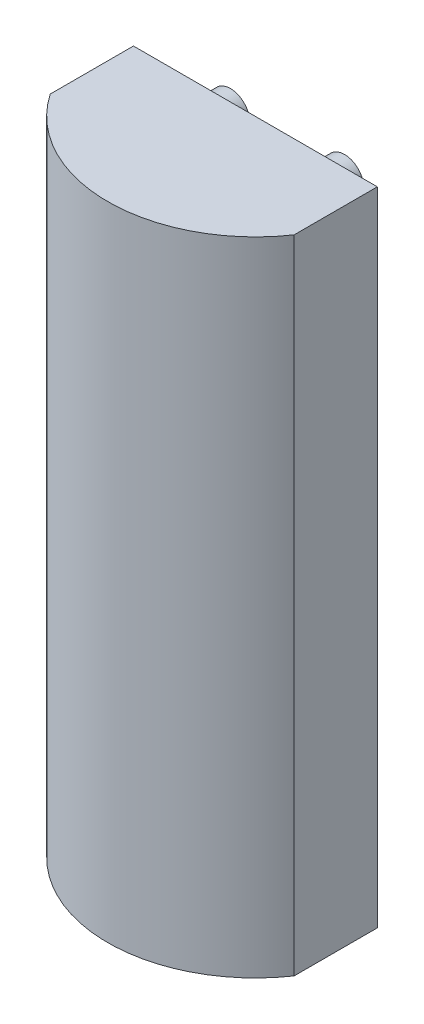
from build123d import *

# Parameters (mm, degrees)
EXTRUDE_1_DEPTH     = 100
SKETCH_2_R          = 3
SKETCH_2_R_2        = 0.9
EXTRUDE_2_DEPTH     = 5
SKETCH_4_W          = 66.593168222
SKETCH_4_H          = 122.189299492
SKETCH_4_W_2        = 38
SKETCH_4_H_2        = 100
CUT_EXTRUDE_1_DEPTH = 106.157025443


with BuildPart() as part:
    # Эскиз1 → Бобышка-Вытянуть1 (new body)
    with BuildSketch(Plane(origin=(0, 0, 0), x_dir=(1, 0, 0), z_dir=(0, 1, 0))):
        with BuildLine():
            Line((-23, 0), (23, 0))
            ThreePointArc((23, 0), (0, -23), (-23, 0))
        make_face()
    extrude(amount=EXTRUDE_1_DEPTH)

    # Эскиз2 → Бобышка-Вытянуть2 (add)
    # profile 1 of 4: a face of its own
    with BuildSketch(Plane(origin=(0, 0, 0), x_dir=(-1, 0, 0), z_dir=(0, 0, -1))):
        with Locations((-8.89, 93.815)):
            Circle(SKETCH_2_R)
        with Locations((-8.89, 93.815)):
            Circle(SKETCH_2_R_2, mode=Mode.SUBTRACT)
    # profile 2 of 4: a face of its own
    with BuildSketch(Plane(origin=(0, 0, 0), x_dir=(-1, 0, 0), z_dir=(0, 0, -1))):
        with Locations((8.89, 93.815)):
            Circle(SKETCH_2_R)
        with Locations((8.89, 93.815)):
            Circle(SKETCH_2_R_2, mode=Mode.SUBTRACT)
    # profile 3 of 4: a face of its own
    with BuildSketch(Plane(origin=(0, 0, 0), x_dir=(-1, 0, 0), z_dir=(0, 0, -1))):
        with Locations((-8.89, 6.185)):
            Circle(SKETCH_2_R)
        with Locations((-8.89, 6.185)):
            Circle(SKETCH_2_R_2, mode=Mode.SUBTRACT)
    # profile 4 of 4: a face of its own
    with BuildSketch(Plane(origin=(0, 0, 0), x_dir=(-1, 0, 0), z_dir=(0, 0, -1))):
        with Locations((8.89, 6.185)):
            Circle(SKETCH_2_R)
        with Locations((8.89, 6.185)):
            Circle(SKETCH_2_R_2, mode=Mode.SUBTRACT)
    extrude(amount=EXTRUDE_2_DEPTH)

    # Эскиз4 → Вырез-Вытянуть1 (cut, through all)
    with BuildSketch(Plane(origin=(0, 0, 0), x_dir=(-1, 0, 0), z_dir=(0, 0, -1))):
        with Locations((0, 49.541790127)):
            Rectangle(SKETCH_4_W, SKETCH_4_H)
        with Locations((0, 50)):
            Rectangle(SKETCH_4_W_2, SKETCH_4_H_2, mode=Mode.SUBTRACT)
    extrude(amount=-CUT_EXTRUDE_1_DEPTH, mode=Mode.SUBTRACT)


solid = part.part
